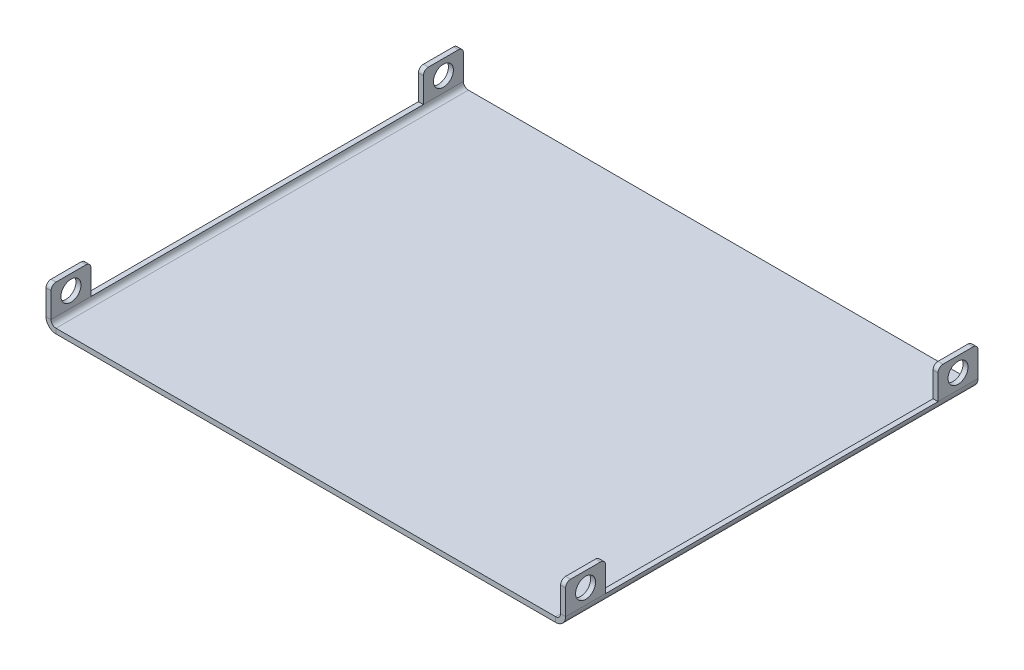
from build123d import *

# Parameters (mm, degrees)
SKETCH1_W                      = 104.072
SKETCH1_H                      = 82.6
BASE_FLANGE2_DEPTH             = 1
EDGE_FLANGE1_STRIP_W           = 6
EDGE_FLANGE1_STRIP_H           = 1
EDGE_FLANGE1_STRIP_CUT_DEPTH   = 82.6
EDGE_FLANGE1_STRIP_2_W         = 6
EDGE_FLANGE1_STRIP_2_H         = 1
EDGE_FLANGE1_STRIP_CUT_2_DEPTH = 82.6
EDGE_FLANGE1_DEPTH             = 82.6
EDGE_FLANGE1_BEND_DEPTH        = 82.6
SKETCH16_W                     = 66.6
SKETCH16_H                     = 7
CUT_EXTRUDE1_DEPTH             = 134.051648558
FILLET1_R                      = 1
SKETCH17_R                     = 2
CUT_EXTRUDE2_DEPTH             = 134.051648558


# Sheet-metal steps are written as plain solids
with BuildPart() as part:
    # Sketch1 → Base-Flange2 (new body)
    with BuildSketch(Plane(origin=(0, 0, 0), x_dir=(1, 0, 0), z_dir=(0, 1, 0))):
        with Locations((52.036, 41.3)):
            Rectangle(SKETCH1_W, SKETCH1_H)
    extrude(amount=-BASE_FLANGE2_DEPTH)

    # Edge-Flange1 strip (across the edge) → Edge-Flange1 strip cut (cut)
    with BuildSketch(Plane(origin=(104.072, 0, 0), x_dir=(-1, 0, 0), z_dir=(0, 0, -1))):
        with Locations((-1, -0.5)):
            Rectangle(EDGE_FLANGE1_STRIP_W, EDGE_FLANGE1_STRIP_H)
    extrude(amount=EDGE_FLANGE1_STRIP_CUT_DEPTH, mode=Mode.SUBTRACT)

    # Edge-Flange1 strip 2 (across the edge) → Edge-Flange1 strip cut 2 (cut)
    with BuildSketch(Plane.XY.offset(-82.6)):
        with Locations((-1, -0.5)):
            Rectangle(EDGE_FLANGE1_STRIP_2_W, EDGE_FLANGE1_STRIP_2_H)
    extrude(amount=EDGE_FLANGE1_STRIP_CUT_2_DEPTH, mode=Mode.SUBTRACT)

    # Edge-Flange1 section (across the edge) → Edge-Flange1 (add)
    with BuildSketch(Plane(origin=(104.072, 0, 0), x_dir=(-1, 0, 0), z_dir=(0, 0, -1))):
        with BuildLine():
            Line((0, 1), (0, 7))
            Line((0, 7), (1, 7))
            Line((1, 7), (1, 1))
            ThreePointArc((1, 1), (1.292893219, 0.292893219), (2, 0))
            Line((2, 0), (2, -1))
            ThreePointArc((2, -1), (0.585786438, -0.414213562), (0, 1))
        make_face()
    extrude(amount=EDGE_FLANGE1_DEPTH)

    # Edge-Flange1 section 2 (across the edge) → Edge-Flange1 bend (add)
    with BuildSketch(Plane.XY.offset(-82.6)):
        with BuildLine():
            Line((0, 1), (0, 7))
            Line((0, 7), (1, 7))
            Line((1, 7), (1, 1))
            ThreePointArc((1, 1), (1.292893219, 0.292893219), (2, 0))
            Line((2, 0), (2, -1))
            ThreePointArc((2, -1), (0.585786438, -0.414213562), (0, 1))
        make_face()
    extrude(amount=EDGE_FLANGE1_BEND_DEPTH)

    # Sketch16 → Cut-Extrude1 (cut, through all)
    with BuildSketch(Plane(origin=(104.072, 0, 0), x_dir=(0, 0, -1), z_dir=(1, 0, 0))):
        with Locations((41.3, 4.5)):
            Rectangle(SKETCH16_W, SKETCH16_H)
    extrude(amount=-CUT_EXTRUDE1_DEPTH, mode=Mode.SUBTRACT)

    # Fillet1
    fillet1_edges = [part.edges().sort_by_distance(p)[0] for p in [
        (103.572, 7, 0),
        (103.572, 7, -82.6),
        (0.5, 7, -82.6),
        (0.5, 7, 0),
        (0.5, 7, -74.6),
        (0.5, 7, -8),
        (103.572, 7, -8),
        (103.572, 7, -74.6),
    ]]
    fillet(fillet1_edges, radius=FILLET1_R)

    # Sketch17 → Cut-Extrude2 (cut, through all)
    with BuildSketch(Plane(origin=(104.072, 0, 0), x_dir=(0, 0, -1), z_dir=(1, 0, 0))):
        with Locations(Location((4, 4, 0), (0, 0, 90))):
            Circle(SKETCH17_R)
        with Locations(Location((78.6, 4, 0), (0, 0, 90))):
            Circle(SKETCH17_R)
    extrude(amount=-CUT_EXTRUDE2_DEPTH, mode=Mode.SUBTRACT)


solid = part.part
